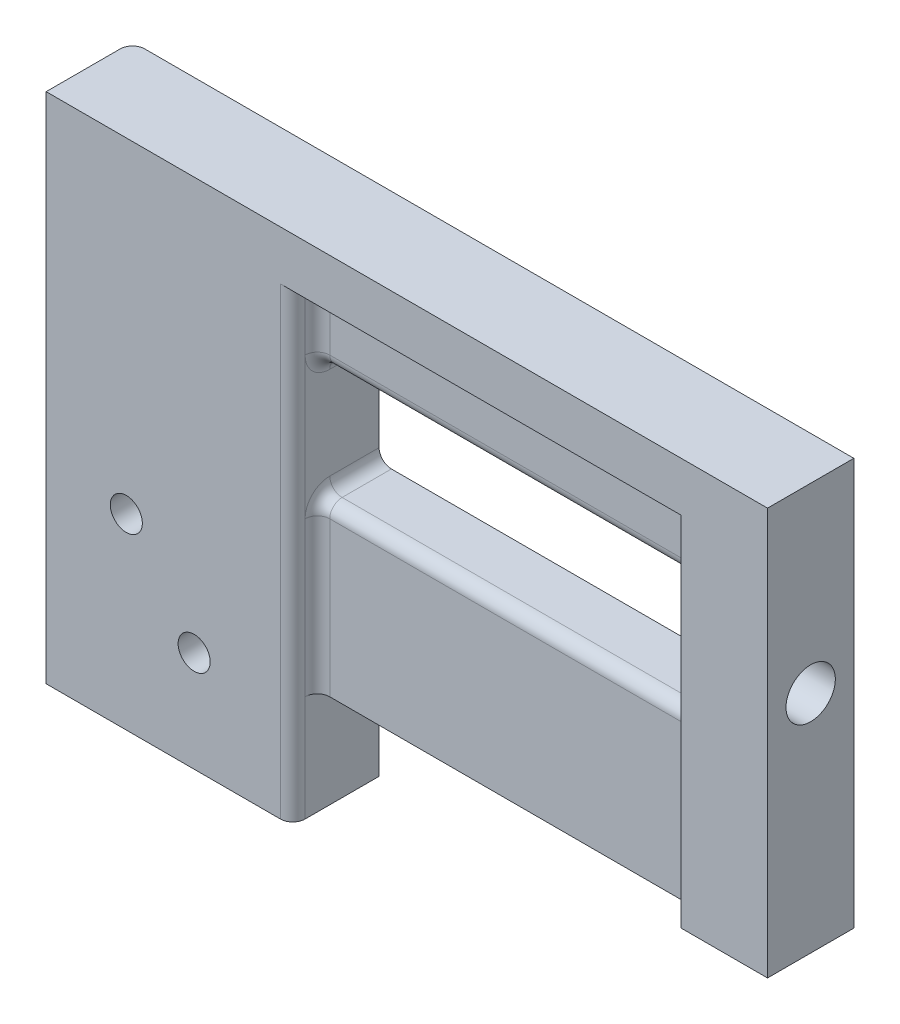
from build123d import *

# Parameters (mm, degrees)
SKETCH1_W           = 31.5
SKETCH1_H           = 9.5
BOSS_EXTRUDE1_DEPTH = 5
BOSS_EXTRUDE2_DEPTH = 7
CUT_EXTRUDE1_START  = 22.75
SKETCH4_R           = 2
CUT_EXTRUDE1_DEPTH  = 7
SKETCH5_R           = 1.3
CUT_EXTRUDE2_DEPTH  = 7
FILLET2_R           = 1


with BuildPart() as part:
    # Sketch1 → Boss-Extrude1 (new body)
    with BuildSketch(Plane.XY):
        Polygon((-15.75, -13.5), (22.75, -13.5), (22.75, 19.5), (-15.75, 19.5), (-19.75, 19.5), (-19.75, -13.5), align=None)
        with Locations((0, 4.75)):
            Rectangle(SKETCH1_W, SKETCH1_H, mode=Mode.SUBTRACT)
    extrude(amount=BOSS_EXTRUDE1_DEPTH)

    # Sketch2 → Boss-Extrude2 (add)
    with BuildSketch(Plane.XY):
        Polygon((-15.75, 19.5), (-35.75, 19.5), (-35.75, -13.5), (-35.75, -22.087493002), (-15.75, -22.087493002), (-15.75, -13.5), (-15.75, 15.5), (15.75, 15.5), (15.75, 0), (15.75, -13.5), (16.597702011, -13.5), (22.75, -13.5), (22.75, 19.5), (15.756062461, 19.5), align=None)
    extrude(amount=BOSS_EXTRUDE2_DEPTH)

    # Sketch4 → Cut-Extrude1 (cut)
    with BuildSketch(Plane(origin=(0, 0, 0), x_dir=(0, 0, -1), z_dir=(1, 0, 0)).offset(CUT_EXTRUDE1_START)):
        with Locations(Location((-3.5, 4.75, 0), (0, 0, 180))):
            Circle(SKETCH4_R)
    extrude(amount=-CUT_EXTRUDE1_DEPTH, mode=Mode.SUBTRACT)

    # Sketch5 → Cut-Extrude2 (cut)
    with BuildSketch(Plane.XY):
        with Locations((-23.75, -13.91)):
            Circle(SKETCH5_R)
        with Locations((-29.25, -6.91)):
            Circle(SKETCH5_R)
    extrude(amount=CUT_EXTRUDE2_DEPTH, mode=Mode.SUBTRACT)

    # Fillet2
    fillet2_edges = [part.edges().sort_by_distance(p)[0] for p in [
        (-15.75, -6.75, 5),
        (0, 15.5, 5),
        (-15.75, 12.5, 5),
        (-15.75, 0, 2.5),
        (-15.75, 9.5, 2.5),
        (-15.75, -3.293746501, 7),
        (0, 0, 5),
        (0, 9.5, 5),
        (-35.75, -1.293746501, 0),
    ]]
    fillet(fillet2_edges, radius=FILLET2_R - 0.0001)  # a hair under: the kernel refuses the full size


solid = part.part
